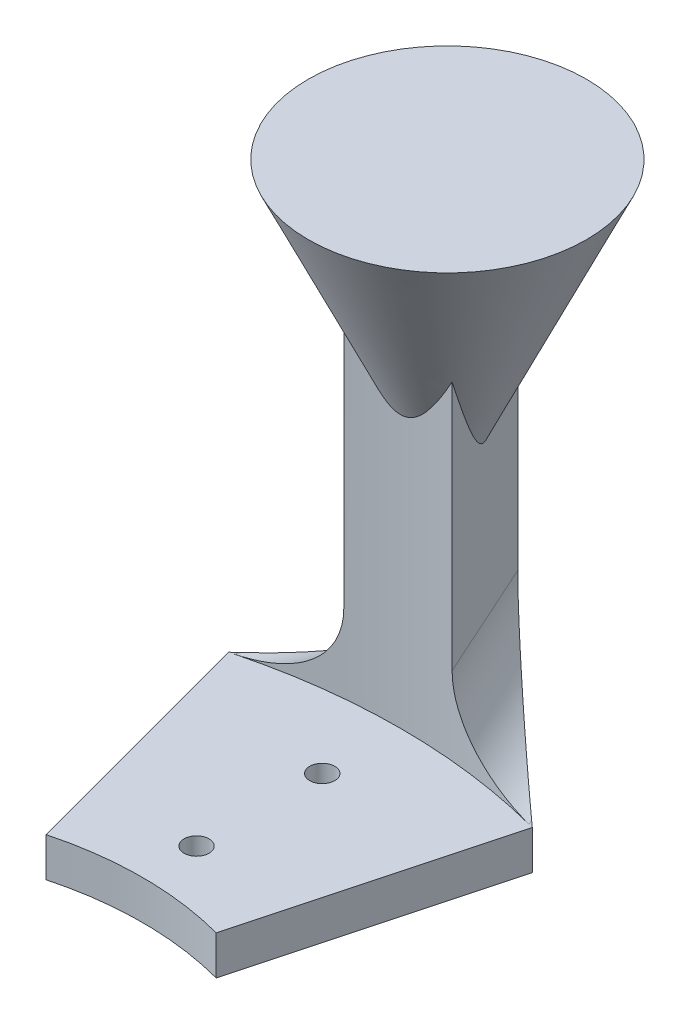
from build123d import *

# Parameters (mm, degrees)
SKETCH_1_R      = 1.6
EXTRUDE_1_DEPTH = 5
EXTRUDE_2_DEPTH = 60
FILLET_2_R      = 10
FILLET_3_R      = 10


with BuildPart() as part:
    # 草图1 → 凸台-拉伸1 (new body)
    with BuildSketch(Plane(origin=(0, 0, 0), x_dir=(1, 0, 0), z_dir=(0, 1, 0))):
        with BuildLine():
            ThreePointArc((-10.870399894, 40.568884704), (0, 42), (10.870399894, 40.568884704))
            Line((10.870399894, 40.568884704), (19.411428383, 72.444436972))
            Line((19.411428383, 72.444436972), (0, 90))
            Line((0, 90), (-19.411428383, 72.444436972))
            Line((-19.411428383, 72.444436972), (-10.870399894, 40.568884704))
        make_face()
        with Locations(Location((0, 65, 0), (0, 0, 270))):
            Circle(SKETCH_1_R, mode=Mode.SUBTRACT)
        with Locations(Location((0, 48.92241394, 0), (0, 0, 270))):
            Circle(SKETCH_1_R, mode=Mode.SUBTRACT)
    extrude(amount=EXTRUDE_1_DEPTH)

    # 草图5 → 凸台-拉伸2 (add)
    with BuildSketch(Plane(origin=(0, 5, 0), x_dir=(1, 0, 0), z_dir=(0, 1, 0))):
        with BuildLine():
            Line((0, 90), (-6.925726506, 74.679544136))
            ThreePointArc((-6.925726506, 74.679544136), (0, 75), (6.925726506, 74.679544136))
            Line((6.925726506, 74.679544136), (0, 90))
        make_face()
    extrude(amount=EXTRUDE_2_DEPTH)

    # 旋转1: read off the stored shape, not the designer's step
    # 旋转1: loft between two sections, ruled curve by curve
    revolve_1_from = [
        Edge.make_three_point_arc((1e-09, 34.818833313, -84.706290842), (-3.706290842, 34.818833313, -81.000000001), (0, 34.818833313, -77.293709158)),
        Edge.make_three_point_arc((0, 34.818833313, -77.293709158), (3.706290842, 34.818833313, -81), (1e-09, 34.818833313, -84.706290842)),
    ]
    revolve_1_to = [
        Edge.make_three_point_arc((3e-09, 65, -98.78), (-17.78, 65, -81.000000003), (-2e-09, 65, -63.22)),
        Edge.make_three_point_arc((-2e-09, 65, -63.22), (17.78, 65, -80.999999999), (3e-09, 65, -98.78)),
    ]
    revolve_1 = Solid(Shell([*[Face.make_surface_from_curves(revolve_1_from[k], revolve_1_to[k]) for k in range(2)], Face(Wire(revolve_1_from)), Face(Wire(revolve_1_to))]))
    add(revolve_1)

    # 圆角2
    # the kernel refuses this fillet: 10 mm, written as the material it adds along each edge
    with BuildSketch(Plane(origin=(17.223805664, 5, -51.899079574), x_dir=(0.9112185824712705, 0, -0.4119231663296544), z_dir=(-0.4119231663296544, 0, -0.9112185824712706))) as fillet_2_piece_1_section:
        with BuildLine():
            CenterArc((FILLET_2_R, -FILLET_2_R), FILLET_2_R, 90, 90)
            Line((0, -FILLET_2_R), (0, 0))
            Line((0, 0), (FILLET_2_R, 0))
        make_face()
    fillet_2_piece_1 = extrude(amount=66.813151267, mode=Mode.PRIVATE)
    fillet_2_piece_1 = split(fillet_2_piece_1, bisect_by=Plane(origin=(28.429094155, 5, -64.28892174), z_dir=(-0.6707629255291222, 0, 0.7416718261708566)), keep=Keep.TOP, mode=Mode.PRIVATE)
    fillet_2_piece_1 = split(fillet_2_piece_1, bisect_by=Plane(origin=(-11.378711034, 5, -64.829060887), z_dir=(0.9112185824712704, 0, 0.411923166329655)), keep=Keep.TOP, mode=Mode.PRIVATE)
    fillet_2_piece_1 = fillet_2_piece_1 - Plane(origin=(0, 5, 0), x_dir=(-0.09234302007576177, 0, -0.9957272551473558), z_dir=(0, -1, 0)) * Cylinder(75, 174, mode=Mode.PRIVATE)
    add(fillet_2_piece_1)

    # 圆角3
    # the kernel refuses this fillet: 10 mm, written as the material it adds along each edge
    with BuildSketch(Plane(origin=(10.298079158, 5, -112.780464562), x_dir=(-0.9112185824712703, 0, -0.41192316632965503), z_dir=(-0.411923166329655, 0, 0.9112185824712704))) as fillet_3_piece_1_section:
        with BuildLine():
            CenterArc((FILLET_3_R, -FILLET_3_R), FILLET_3_R, 90, 90)
            Line((0, -FILLET_3_R), (0, 0))
            Line((0, 0), (FILLET_3_R, 0))
        make_face()
    fillet_3_piece_1 = extrude(amount=66.813151267, mode=Mode.PRIVATE)
    fillet_3_piece_1 = split(fillet_3_piece_1, bisect_by=Plane(origin=(16.997698866, 5, -105.372602567), z_dir=(0.6707629255291219, 0, 0.7416718261708569)), keep=Keep.TOP, mode=Mode.PRIVATE)
    fillet_3_piece_1 = fillet_3_piece_1 - Plane(origin=(0, 5, 0), x_dir=(-0.0923430200760307, 0, -0.995727255147331), z_dir=(0, -1, 0)) * Cylinder(75, 174, mode=Mode.PRIVATE)
    fillet_3_piece_1 = split(fillet_3_piece_1, bisect_by=Plane(origin=(-5.668223875, 5, -95.126302894), z_dir=(-0.6707629255289835, 0, 0.7416718261709819)), keep=Keep.TOP, mode=Mode.PRIVATE)
    add(fillet_3_piece_1)


solid = part.part
